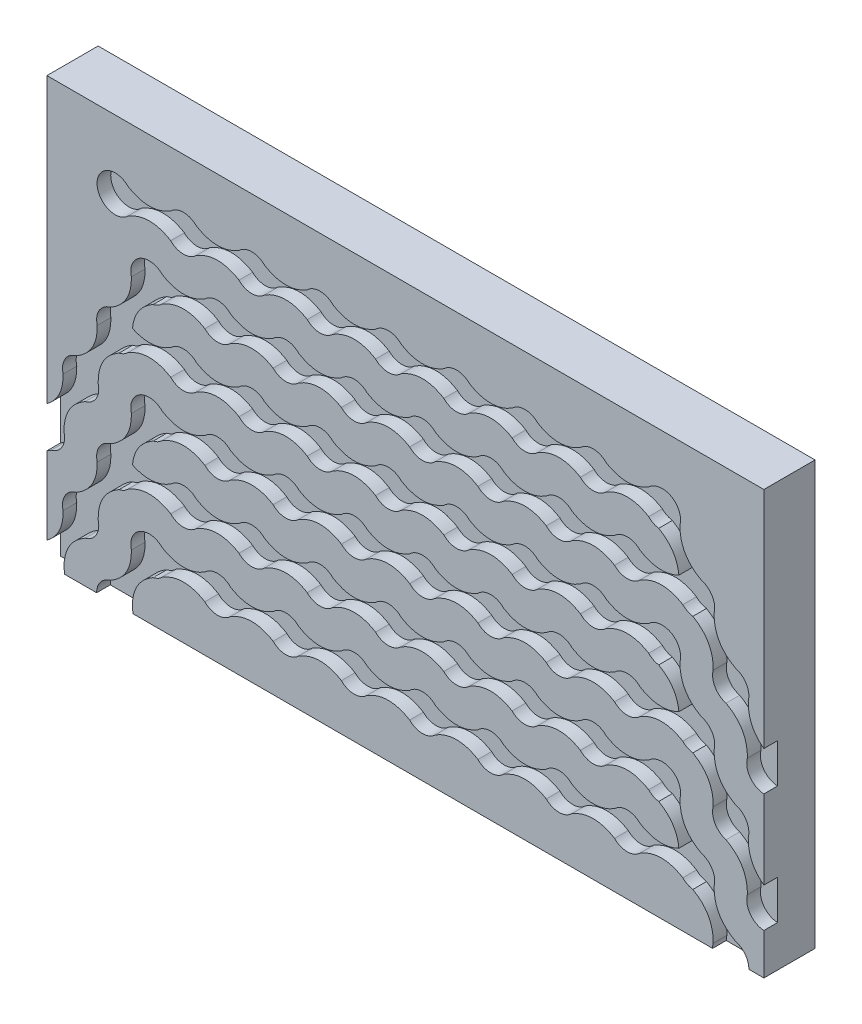
from build123d import *

# Parameters (mm, degrees)
SKETCH2_W               = 133.35
SKETCH2_H               = 78.691135768
BOSS_EXTRUDE1_DEPTH     = 9.525
CUT_EXTRUDE1_DEPTH      = 2.54
LPATTERN1_COUNT         = 8
LPATTERN1_PITCH         = 12.7
LPATTERN3_COPY_1_DEPTH  = 2.54
LPATTERN3_COPY_2_DEPTH  = 2.54
LPATTERN3_COPY_3_DEPTH  = 2.54
LPATTERN3_COPY_4_DEPTH  = 2.54
LPATTERN3_COPY_5_DEPTH  = 2.54
LPATTERN3_COPY_6_DEPTH  = 2.54
LPATTERN3_COPY_7_DEPTH  = 2.54
LPATTERN3_COPY_8_DEPTH  = 2.54
LPATTERN4_COUNT         = 3
LPATTERN4_PITCH         = 21.997045256
LPATTERN4_COPY_1_DEPTH  = 2.54
LPATTERN4_COPY_2_DEPTH  = 2.54
LPATTERN4_COPY_3_DEPTH  = 2.54
LPATTERN4_COPY_4_DEPTH  = 2.54
LPATTERN4_COPY_5_DEPTH  = 2.54
LPATTERN4_COPY_6_DEPTH  = 2.54
LPATTERN4_COPY_7_DEPTH  = 2.54
LPATTERN4_COPY_8_DEPTH  = 2.54
LPATTERN4_COPY_9_DEPTH  = 2.54
LPATTERN4_COPY_10_DEPTH = 2.54
LPATTERN4_COPY_11_DEPTH = 2.54
LPATTERN4_COPY_12_DEPTH = 2.54
LPATTERN4_COPY_13_DEPTH = 2.54
LPATTERN4_COPY_14_DEPTH = 2.54
LPATTERN4_COPY_15_DEPTH = 2.54
LPATTERN4_COPY_16_DEPTH = 2.54
LPATTERN4_COPY_17_DEPTH = 2.54
LPATTERN4_COPY_18_DEPTH = 2.54
LPATTERN4_COPY_19_DEPTH = 2.54
LPATTERN4_COPY_20_DEPTH = 2.54
LPATTERN4_COPY_21_DEPTH = 2.54
LPATTERN4_COPY_22_DEPTH = 2.54
LPATTERN4_COPY_23_DEPTH = 2.54
LPATTERN4_COPY_24_DEPTH = 2.54
LPATTERN4_COPY_25_DEPTH = 2.54
LPATTERN4_COPY_26_DEPTH = 2.54
LPATTERN4_COPY_27_DEPTH = 2.54
LPATTERN4_COPY_28_DEPTH = 2.54
LPATTERN4_COPY_29_DEPTH = 2.54
LPATTERN4_COPY_30_DEPTH = 2.54
CUT_EXTRUDE2_DEPTH      = 2.54
LPATTERN5_COUNT         = 3
LPATTERN5_PITCH         = 12.7
LPATTERN6_COPY_1_DEPTH  = 2.54
LPATTERN6_COPY_2_DEPTH  = 2.54
LPATTERN6_COPY_3_DEPTH  = 2.54
LPATTERN6_COPY_4_DEPTH  = 2.54
LPATTERN6_COPY_5_DEPTH  = 2.54
LPATTERN6_COPY_6_DEPTH  = 2.54
CUT_EXTRUDE3_DEPTH      = 2.54
LPATTERN7_COUNT         = 4
LPATTERN7_PITCH         = 12.7
LPATTERN8_COPY_1_DEPTH  = 2.54
LPATTERN8_COPY_2_DEPTH  = 2.54
LPATTERN8_COPY_3_DEPTH  = 2.54
LPATTERN8_COPY_4_DEPTH  = 2.54
LPATTERN8_COPY_5_DEPTH  = 2.54
LPATTERN8_COPY_6_DEPTH  = 2.54
LPATTERN8_COPY_7_DEPTH  = 2.54
LPATTERN8_COPY_8_DEPTH  = 2.54
SCALE1_SCALE            = 0.75


with BuildPart() as part:
    # Sketch2 → Boss-Extrude1 (new body)
    with BuildSketch(Plane.XY):
        with Locations((35.614124974, 7.974602086)):
            Rectangle(SKETCH2_W, SKETCH2_H)
    extrude(amount=BOSS_EXTRUDE1_DEPTH)

    # Sketch1 → Cut-Extrude1 (cut)
    with BuildSketch(Plane.XY.offset(9.525)):
        with BuildLine():
            ThreePointArc((-15.975494494, 37.005550502), (-21.734312526, 34.62016997), (-15.975494494, 32.234789438))
            add(Edge.make_bspline(
                [(-15.975494494, 32.234789438), (-12.010875026, 34.624300502), (-8.046255558, 32.234789438)],
                knots=[0, 0, 0, 1, 1, 1], degree=2))
            ThreePointArc((-8.046255558, 32.234789438), (-2.287437526, 34.62016997), (-8.046255558, 37.005550502))
            add(Edge.make_bspline(
                [(-15.975494494, 37.005550502), (-12.010875026, 34.616039438), (-8.046255558, 37.005550502)],
                knots=[0, 0, 0, 1, 1, 1], degree=2))
        make_face()
    cut_extrude1 = extrude(amount=-CUT_EXTRUDE1_DEPTH, mode=Mode.SUBTRACT)

    # LPattern1: Cut-Extrude1 ×8
    with Locations(*[(i * LPATTERN1_PITCH, 0, 0) for i in range(1, LPATTERN1_COUNT)]):
        add(cut_extrude1, mode=Mode.SUBTRACT)

    # LPattern3 copy 1 sketch → LPattern3 copy 1 (cut)
    with BuildSketch(Plane(origin=(19.05, -10.998522628, 9.525), x_dir=(1, 0, 0), z_dir=(0, 0, 1))):
        with BuildLine():
            ThreePointArc((-15.975494494, 37.005550502), (-21.734312526, 34.62016997), (-15.975494494, 32.234789438))
            add(Edge.make_bspline(
                [(-15.975494494, 32.234789438), (-12.010875026, 34.624300502), (-8.046255558, 32.234789438)],
                knots=[0, 0, 0, 1, 1, 1], degree=2))
            ThreePointArc((-8.046255558, 32.234789438), (-2.287437526, 34.62016997), (-8.046255558, 37.005550502))
            add(Edge.make_bspline(
                [(-15.975494494, 37.005550502), (-12.010875026, 34.616039438), (-8.046255558, 37.005550502)],
                knots=[0, 0, 0, 1, 1, 1], degree=2))
        make_face()
    extrude(amount=-LPATTERN3_COPY_1_DEPTH, mode=Mode.SUBTRACT)

    # LPattern3 copy 2 sketch → LPattern3 copy 2 (cut)
    with BuildSketch(Plane(origin=(31.75, -10.998522628, 9.525), x_dir=(1, 0, 0), z_dir=(0, 0, 1))):
        with BuildLine():
            ThreePointArc((-15.975494494, 37.005550502), (-21.734312526, 34.62016997), (-15.975494494, 32.234789438))
            add(Edge.make_bspline(
                [(-15.975494494, 32.234789438), (-12.010875026, 34.624300502), (-8.046255558, 32.234789438)],
                knots=[0, 0, 0, 1, 1, 1], degree=2))
            ThreePointArc((-8.046255558, 32.234789438), (-2.287437526, 34.62016997), (-8.046255558, 37.005550502))
            add(Edge.make_bspline(
                [(-15.975494494, 37.005550502), (-12.010875026, 34.616039438), (-8.046255558, 37.005550502)],
                knots=[0, 0, 0, 1, 1, 1], degree=2))
        make_face()
    extrude(amount=-LPATTERN3_COPY_2_DEPTH, mode=Mode.SUBTRACT)

    # LPattern3 copy 3 sketch → LPattern3 copy 3 (cut)
    with BuildSketch(Plane(origin=(44.45, -10.998522628, 9.525), x_dir=(1, 0, 0), z_dir=(0, 0, 1))):
        with BuildLine():
            ThreePointArc((-15.975494494, 37.005550502), (-21.734312526, 34.62016997), (-15.975494494, 32.234789438))
            add(Edge.make_bspline(
                [(-15.975494494, 32.234789438), (-12.010875026, 34.624300502), (-8.046255558, 32.234789438)],
                knots=[0, 0, 0, 1, 1, 1], degree=2))
            ThreePointArc((-8.046255558, 32.234789438), (-2.287437526, 34.62016997), (-8.046255558, 37.005550502))
            add(Edge.make_bspline(
                [(-15.975494494, 37.005550502), (-12.010875026, 34.616039438), (-8.046255558, 37.005550502)],
                knots=[0, 0, 0, 1, 1, 1], degree=2))
        make_face()
    extrude(amount=-LPATTERN3_COPY_3_DEPTH, mode=Mode.SUBTRACT)

    # LPattern3 copy 4 sketch → LPattern3 copy 4 (cut)
    with BuildSketch(Plane(origin=(57.15, -10.998522628, 9.525), x_dir=(1, 0, 0), z_dir=(0, 0, 1))):
        with BuildLine():
            ThreePointArc((-15.975494494, 37.005550502), (-21.734312526, 34.62016997), (-15.975494494, 32.234789438))
            add(Edge.make_bspline(
                [(-15.975494494, 32.234789438), (-12.010875026, 34.624300502), (-8.046255558, 32.234789438)],
                knots=[0, 0, 0, 1, 1, 1], degree=2))
            ThreePointArc((-8.046255558, 32.234789438), (-2.287437526, 34.62016997), (-8.046255558, 37.005550502))
            add(Edge.make_bspline(
                [(-15.975494494, 37.005550502), (-12.010875026, 34.616039438), (-8.046255558, 37.005550502)],
                knots=[0, 0, 0, 1, 1, 1], degree=2))
        make_face()
    extrude(amount=-LPATTERN3_COPY_4_DEPTH, mode=Mode.SUBTRACT)

    # LPattern3 copy 5 sketch → LPattern3 copy 5 (cut)
    with BuildSketch(Plane(origin=(69.85, -10.998522628, 9.525), x_dir=(1, 0, 0), z_dir=(0, 0, 1))):
        with BuildLine():
            ThreePointArc((-15.975494494, 37.005550502), (-21.734312526, 34.62016997), (-15.975494494, 32.234789438))
            add(Edge.make_bspline(
                [(-15.975494494, 32.234789438), (-12.010875026, 34.624300502), (-8.046255558, 32.234789438)],
                knots=[0, 0, 0, 1, 1, 1], degree=2))
            ThreePointArc((-8.046255558, 32.234789438), (-2.287437526, 34.62016997), (-8.046255558, 37.005550502))
            add(Edge.make_bspline(
                [(-15.975494494, 37.005550502), (-12.010875026, 34.616039438), (-8.046255558, 37.005550502)],
                knots=[0, 0, 0, 1, 1, 1], degree=2))
        make_face()
    extrude(amount=-LPATTERN3_COPY_5_DEPTH, mode=Mode.SUBTRACT)

    # LPattern3 copy 6 sketch → LPattern3 copy 6 (cut)
    with BuildSketch(Plane(origin=(82.55, -10.998522628, 9.525), x_dir=(1, 0, 0), z_dir=(0, 0, 1))):
        with BuildLine():
            ThreePointArc((-15.975494494, 37.005550502), (-21.734312526, 34.62016997), (-15.975494494, 32.234789438))
            add(Edge.make_bspline(
                [(-15.975494494, 32.234789438), (-12.010875026, 34.624300502), (-8.046255558, 32.234789438)],
                knots=[0, 0, 0, 1, 1, 1], degree=2))
            ThreePointArc((-8.046255558, 32.234789438), (-2.287437526, 34.62016997), (-8.046255558, 37.005550502))
            add(Edge.make_bspline(
                [(-15.975494494, 37.005550502), (-12.010875026, 34.616039438), (-8.046255558, 37.005550502)],
                knots=[0, 0, 0, 1, 1, 1], degree=2))
        make_face()
    extrude(amount=-LPATTERN3_COPY_6_DEPTH, mode=Mode.SUBTRACT)

    # LPattern3 copy 7 sketch → LPattern3 copy 7 (cut)
    with BuildSketch(Plane(origin=(95.25, -10.998522628, 9.525), x_dir=(1, 0, 0), z_dir=(0, 0, 1))):
        with BuildLine():
            ThreePointArc((-15.975494494, 37.005550502), (-21.734312526, 34.62016997), (-15.975494494, 32.234789438))
            add(Edge.make_bspline(
                [(-15.975494494, 32.234789438), (-12.010875026, 34.624300502), (-8.046255558, 32.234789438)],
                knots=[0, 0, 0, 1, 1, 1], degree=2))
            ThreePointArc((-8.046255558, 32.234789438), (-2.287437526, 34.62016997), (-8.046255558, 37.005550502))
            add(Edge.make_bspline(
                [(-15.975494494, 37.005550502), (-12.010875026, 34.616039438), (-8.046255558, 37.005550502)],
                knots=[0, 0, 0, 1, 1, 1], degree=2))
        make_face()
    extrude(amount=-LPATTERN3_COPY_7_DEPTH, mode=Mode.SUBTRACT)

    # LPattern3 copy 8 sketch → LPattern3 copy 8 (cut)
    with BuildSketch(Plane(origin=(6.35, -10.998522628, 9.525), x_dir=(1, 0, 0), z_dir=(0, 0, 1))):
        with BuildLine():
            ThreePointArc((-15.975494494, 37.005550502), (-21.734312526, 34.62016997), (-15.975494494, 32.234789438))
            add(Edge.make_bspline(
                [(-15.975494494, 32.234789438), (-12.010875026, 34.624300502), (-8.046255558, 32.234789438)],
                knots=[0, 0, 0, 1, 1, 1], degree=2))
            ThreePointArc((-8.046255558, 32.234789438), (-2.287437526, 34.62016997), (-8.046255558, 37.005550502))
            add(Edge.make_bspline(
                [(-15.975494494, 37.005550502), (-12.010875026, 34.616039438), (-8.046255558, 37.005550502)],
                knots=[0, 0, 0, 1, 1, 1], degree=2))
        make_face()
    extrude(amount=-LPATTERN3_COPY_8_DEPTH, mode=Mode.SUBTRACT)

    # LPattern4: Cut-Extrude1 ×3
    with Locations(*[(0, -i * LPATTERN4_PITCH, 0) for i in range(1, LPATTERN4_COUNT)]):
        add(cut_extrude1, mode=Mode.SUBTRACT)

    # LPattern4 copy 1 sketch → LPattern4 copy 1 (cut)
    with BuildSketch(Plane(origin=(12.7, -21.997045256, 9.525), x_dir=(1, 0, 0), z_dir=(0, 0, 1))):
        with BuildLine():
            ThreePointArc((-15.975494494, 37.005550502), (-21.734312526, 34.62016997), (-15.975494494, 32.234789438))
            add(Edge.make_bspline(
                [(-15.975494494, 32.234789438), (-12.010875026, 34.624300502), (-8.046255558, 32.234789438)],
                knots=[0, 0, 0, 1, 1, 1], degree=2))
            ThreePointArc((-8.046255558, 32.234789438), (-2.287437526, 34.62016997), (-8.046255558, 37.005550502))
            add(Edge.make_bspline(
                [(-15.975494494, 37.005550502), (-12.010875026, 34.616039438), (-8.046255558, 37.005550502)],
                knots=[0, 0, 0, 1, 1, 1], degree=2))
        make_face()
    extrude(amount=-LPATTERN4_COPY_1_DEPTH, mode=Mode.SUBTRACT)

    # LPattern4 copy 2 sketch → LPattern4 copy 2 (cut)
    with BuildSketch(Plane(origin=(12.7, -43.994090512, 9.525), x_dir=(1, 0, 0), z_dir=(0, 0, 1))):
        with BuildLine():
            ThreePointArc((-15.975494494, 37.005550502), (-21.734312526, 34.62016997), (-15.975494494, 32.234789438))
            add(Edge.make_bspline(
                [(-15.975494494, 32.234789438), (-12.010875026, 34.624300502), (-8.046255558, 32.234789438)],
                knots=[0, 0, 0, 1, 1, 1], degree=2))
            ThreePointArc((-8.046255558, 32.234789438), (-2.287437526, 34.62016997), (-8.046255558, 37.005550502))
            add(Edge.make_bspline(
                [(-15.975494494, 37.005550502), (-12.010875026, 34.616039438), (-8.046255558, 37.005550502)],
                knots=[0, 0, 0, 1, 1, 1], degree=2))
        make_face()
    extrude(amount=-LPATTERN4_COPY_2_DEPTH, mode=Mode.SUBTRACT)

    # LPattern4 copy 3 sketch → LPattern4 copy 3 (cut)
    with BuildSketch(Plane(origin=(25.4, -21.997045256, 9.525), x_dir=(1, 0, 0), z_dir=(0, 0, 1))):
        with BuildLine():
            ThreePointArc((-15.975494494, 37.005550502), (-21.734312526, 34.62016997), (-15.975494494, 32.234789438))
            add(Edge.make_bspline(
                [(-15.975494494, 32.234789438), (-12.010875026, 34.624300502), (-8.046255558, 32.234789438)],
                knots=[0, 0, 0, 1, 1, 1], degree=2))
            ThreePointArc((-8.046255558, 32.234789438), (-2.287437526, 34.62016997), (-8.046255558, 37.005550502))
            add(Edge.make_bspline(
                [(-15.975494494, 37.005550502), (-12.010875026, 34.616039438), (-8.046255558, 37.005550502)],
                knots=[0, 0, 0, 1, 1, 1], degree=2))
        make_face()
    extrude(amount=-LPATTERN4_COPY_3_DEPTH, mode=Mode.SUBTRACT)

    # LPattern4 copy 4 sketch → LPattern4 copy 4 (cut)
    with BuildSketch(Plane(origin=(25.4, -43.994090512, 9.525), x_dir=(1, 0, 0), z_dir=(0, 0, 1))):
        with BuildLine():
            ThreePointArc((-15.975494494, 37.005550502), (-21.734312526, 34.62016997), (-15.975494494, 32.234789438))
            add(Edge.make_bspline(
                [(-15.975494494, 32.234789438), (-12.010875026, 34.624300502), (-8.046255558, 32.234789438)],
                knots=[0, 0, 0, 1, 1, 1], degree=2))
            ThreePointArc((-8.046255558, 32.234789438), (-2.287437526, 34.62016997), (-8.046255558, 37.005550502))
            add(Edge.make_bspline(
                [(-15.975494494, 37.005550502), (-12.010875026, 34.616039438), (-8.046255558, 37.005550502)],
                knots=[0, 0, 0, 1, 1, 1], degree=2))
        make_face()
    extrude(amount=-LPATTERN4_COPY_4_DEPTH, mode=Mode.SUBTRACT)

    # LPattern4 copy 5 sketch → LPattern4 copy 5 (cut)
    with BuildSketch(Plane(origin=(38.1, -21.997045256, 9.525), x_dir=(1, 0, 0), z_dir=(0, 0, 1))):
        with BuildLine():
            ThreePointArc((-15.975494494, 37.005550502), (-21.734312526, 34.62016997), (-15.975494494, 32.234789438))
            add(Edge.make_bspline(
                [(-15.975494494, 32.234789438), (-12.010875026, 34.624300502), (-8.046255558, 32.234789438)],
                knots=[0, 0, 0, 1, 1, 1], degree=2))
            ThreePointArc((-8.046255558, 32.234789438), (-2.287437526, 34.62016997), (-8.046255558, 37.005550502))
            add(Edge.make_bspline(
                [(-15.975494494, 37.005550502), (-12.010875026, 34.616039438), (-8.046255558, 37.005550502)],
                knots=[0, 0, 0, 1, 1, 1], degree=2))
        make_face()
    extrude(amount=-LPATTERN4_COPY_5_DEPTH, mode=Mode.SUBTRACT)

    # LPattern4 copy 6 sketch → LPattern4 copy 6 (cut)
    with BuildSketch(Plane(origin=(38.1, -43.994090512, 9.525), x_dir=(1, 0, 0), z_dir=(0, 0, 1))):
        with BuildLine():
            ThreePointArc((-15.975494494, 37.005550502), (-21.734312526, 34.62016997), (-15.975494494, 32.234789438))
            add(Edge.make_bspline(
                [(-15.975494494, 32.234789438), (-12.010875026, 34.624300502), (-8.046255558, 32.234789438)],
                knots=[0, 0, 0, 1, 1, 1], degree=2))
            ThreePointArc((-8.046255558, 32.234789438), (-2.287437526, 34.62016997), (-8.046255558, 37.005550502))
            add(Edge.make_bspline(
                [(-15.975494494, 37.005550502), (-12.010875026, 34.616039438), (-8.046255558, 37.005550502)],
                knots=[0, 0, 0, 1, 1, 1], degree=2))
        make_face()
    extrude(amount=-LPATTERN4_COPY_6_DEPTH, mode=Mode.SUBTRACT)

    # LPattern4 copy 7 sketch → LPattern4 copy 7 (cut)
    with BuildSketch(Plane(origin=(50.8, -21.997045256, 9.525), x_dir=(1, 0, 0), z_dir=(0, 0, 1))):
        with BuildLine():
            ThreePointArc((-15.975494494, 37.005550502), (-21.734312526, 34.62016997), (-15.975494494, 32.234789438))
            add(Edge.make_bspline(
                [(-15.975494494, 32.234789438), (-12.010875026, 34.624300502), (-8.046255558, 32.234789438)],
                knots=[0, 0, 0, 1, 1, 1], degree=2))
            ThreePointArc((-8.046255558, 32.234789438), (-2.287437526, 34.62016997), (-8.046255558, 37.005550502))
            add(Edge.make_bspline(
                [(-15.975494494, 37.005550502), (-12.010875026, 34.616039438), (-8.046255558, 37.005550502)],
                knots=[0, 0, 0, 1, 1, 1], degree=2))
        make_face()
    extrude(amount=-LPATTERN4_COPY_7_DEPTH, mode=Mode.SUBTRACT)

    # LPattern4 copy 8 sketch → LPattern4 copy 8 (cut)
    with BuildSketch(Plane(origin=(50.8, -43.994090512, 9.525), x_dir=(1, 0, 0), z_dir=(0, 0, 1))):
        with BuildLine():
            ThreePointArc((-15.975494494, 37.005550502), (-21.734312526, 34.62016997), (-15.975494494, 32.234789438))
            add(Edge.make_bspline(
                [(-15.975494494, 32.234789438), (-12.010875026, 34.624300502), (-8.046255558, 32.234789438)],
                knots=[0, 0, 0, 1, 1, 1], degree=2))
            ThreePointArc((-8.046255558, 32.234789438), (-2.287437526, 34.62016997), (-8.046255558, 37.005550502))
            add(Edge.make_bspline(
                [(-15.975494494, 37.005550502), (-12.010875026, 34.616039438), (-8.046255558, 37.005550502)],
                knots=[0, 0, 0, 1, 1, 1], degree=2))
        make_face()
    extrude(amount=-LPATTERN4_COPY_8_DEPTH, mode=Mode.SUBTRACT)

    # LPattern4 copy 9 sketch → LPattern4 copy 9 (cut)
    with BuildSketch(Plane(origin=(63.5, -21.997045256, 9.525), x_dir=(1, 0, 0), z_dir=(0, 0, 1))):
        with BuildLine():
            ThreePointArc((-15.975494494, 37.005550502), (-21.734312526, 34.62016997), (-15.975494494, 32.234789438))
            add(Edge.make_bspline(
                [(-15.975494494, 32.234789438), (-12.010875026, 34.624300502), (-8.046255558, 32.234789438)],
                knots=[0, 0, 0, 1, 1, 1], degree=2))
            ThreePointArc((-8.046255558, 32.234789438), (-2.287437526, 34.62016997), (-8.046255558, 37.005550502))
            add(Edge.make_bspline(
                [(-15.975494494, 37.005550502), (-12.010875026, 34.616039438), (-8.046255558, 37.005550502)],
                knots=[0, 0, 0, 1, 1, 1], degree=2))
        make_face()
    extrude(amount=-LPATTERN4_COPY_9_DEPTH, mode=Mode.SUBTRACT)

    # LPattern4 copy 10 sketch → LPattern4 copy 10 (cut)
    with BuildSketch(Plane(origin=(63.5, -43.994090512, 9.525), x_dir=(1, 0, 0), z_dir=(0, 0, 1))):
        with BuildLine():
            ThreePointArc((-15.975494494, 37.005550502), (-21.734312526, 34.62016997), (-15.975494494, 32.234789438))
            add(Edge.make_bspline(
                [(-15.975494494, 32.234789438), (-12.010875026, 34.624300502), (-8.046255558, 32.234789438)],
                knots=[0, 0, 0, 1, 1, 1], degree=2))
            ThreePointArc((-8.046255558, 32.234789438), (-2.287437526, 34.62016997), (-8.046255558, 37.005550502))
            add(Edge.make_bspline(
                [(-15.975494494, 37.005550502), (-12.010875026, 34.616039438), (-8.046255558, 37.005550502)],
                knots=[0, 0, 0, 1, 1, 1], degree=2))
        make_face()
    extrude(amount=-LPATTERN4_COPY_10_DEPTH, mode=Mode.SUBTRACT)

    # LPattern4 copy 11 sketch → LPattern4 copy 11 (cut)
    with BuildSketch(Plane(origin=(76.2, -21.997045256, 9.525), x_dir=(1, 0, 0), z_dir=(0, 0, 1))):
        with BuildLine():
            ThreePointArc((-15.975494494, 37.005550502), (-21.734312526, 34.62016997), (-15.975494494, 32.234789438))
            add(Edge.make_bspline(
                [(-15.975494494, 32.234789438), (-12.010875026, 34.624300502), (-8.046255558, 32.234789438)],
                knots=[0, 0, 0, 1, 1, 1], degree=2))
            ThreePointArc((-8.046255558, 32.234789438), (-2.287437526, 34.62016997), (-8.046255558, 37.005550502))
            add(Edge.make_bspline(
                [(-15.975494494, 37.005550502), (-12.010875026, 34.616039438), (-8.046255558, 37.005550502)],
                knots=[0, 0, 0, 1, 1, 1], degree=2))
        make_face()
    extrude(amount=-LPATTERN4_COPY_11_DEPTH, mode=Mode.SUBTRACT)

    # LPattern4 copy 12 sketch → LPattern4 copy 12 (cut)
    with BuildSketch(Plane(origin=(76.2, -43.994090512, 9.525), x_dir=(1, 0, 0), z_dir=(0, 0, 1))):
        with BuildLine():
            ThreePointArc((-15.975494494, 37.005550502), (-21.734312526, 34.62016997), (-15.975494494, 32.234789438))
            add(Edge.make_bspline(
                [(-15.975494494, 32.234789438), (-12.010875026, 34.624300502), (-8.046255558, 32.234789438)],
                knots=[0, 0, 0, 1, 1, 1], degree=2))
            ThreePointArc((-8.046255558, 32.234789438), (-2.287437526, 34.62016997), (-8.046255558, 37.005550502))
            add(Edge.make_bspline(
                [(-15.975494494, 37.005550502), (-12.010875026, 34.616039438), (-8.046255558, 37.005550502)],
                knots=[0, 0, 0, 1, 1, 1], degree=2))
        make_face()
    extrude(amount=-LPATTERN4_COPY_12_DEPTH, mode=Mode.SUBTRACT)

    # LPattern4 copy 13 sketch → LPattern4 copy 13 (cut)
    with BuildSketch(Plane(origin=(88.9, -21.997045256, 9.525), x_dir=(1, 0, 0), z_dir=(0, 0, 1))):
        with BuildLine():
            ThreePointArc((-15.975494494, 37.005550502), (-21.734312526, 34.62016997), (-15.975494494, 32.234789438))
            add(Edge.make_bspline(
                [(-15.975494494, 32.234789438), (-12.010875026, 34.624300502), (-8.046255558, 32.234789438)],
                knots=[0, 0, 0, 1, 1, 1], degree=2))
            ThreePointArc((-8.046255558, 32.234789438), (-2.287437526, 34.62016997), (-8.046255558, 37.005550502))
            add(Edge.make_bspline(
                [(-15.975494494, 37.005550502), (-12.010875026, 34.616039438), (-8.046255558, 37.005550502)],
                knots=[0, 0, 0, 1, 1, 1], degree=2))
        make_face()
    extrude(amount=-LPATTERN4_COPY_13_DEPTH, mode=Mode.SUBTRACT)

    # LPattern4 copy 14 sketch → LPattern4 copy 14 (cut)
    with BuildSketch(Plane(origin=(88.9, -43.994090512, 9.525), x_dir=(1, 0, 0), z_dir=(0, 0, 1))):
        with BuildLine():
            ThreePointArc((-15.975494494, 37.005550502), (-21.734312526, 34.62016997), (-15.975494494, 32.234789438))
            add(Edge.make_bspline(
                [(-15.975494494, 32.234789438), (-12.010875026, 34.624300502), (-8.046255558, 32.234789438)],
                knots=[0, 0, 0, 1, 1, 1], degree=2))
            ThreePointArc((-8.046255558, 32.234789438), (-2.287437526, 34.62016997), (-8.046255558, 37.005550502))
            add(Edge.make_bspline(
                [(-15.975494494, 37.005550502), (-12.010875026, 34.616039438), (-8.046255558, 37.005550502)],
                knots=[0, 0, 0, 1, 1, 1], degree=2))
        make_face()
    extrude(amount=-LPATTERN4_COPY_14_DEPTH, mode=Mode.SUBTRACT)

    # LPattern4 copy 15 sketch → LPattern4 copy 15 (cut)
    with BuildSketch(Plane(origin=(19.05, -32.995567884, 9.525), x_dir=(1, 0, 0), z_dir=(0, 0, 1))):
        with BuildLine():
            ThreePointArc((-15.975494494, 37.005550502), (-21.734312526, 34.62016997), (-15.975494494, 32.234789438))
            add(Edge.make_bspline(
                [(-15.975494494, 32.234789438), (-12.010875026, 34.624300502), (-8.046255558, 32.234789438)],
                knots=[0, 0, 0, 1, 1, 1], degree=2))
            ThreePointArc((-8.046255558, 32.234789438), (-2.287437526, 34.62016997), (-8.046255558, 37.005550502))
            add(Edge.make_bspline(
                [(-15.975494494, 37.005550502), (-12.010875026, 34.616039438), (-8.046255558, 37.005550502)],
                knots=[0, 0, 0, 1, 1, 1], degree=2))
        make_face()
    extrude(amount=-LPATTERN4_COPY_15_DEPTH, mode=Mode.SUBTRACT)

    # LPattern4 copy 16 sketch → LPattern4 copy 16 (cut)
    with BuildSketch(Plane(origin=(19.05, -54.99261314, 9.525), x_dir=(1, 0, 0), z_dir=(0, 0, 1))):
        with BuildLine():
            ThreePointArc((-15.975494494, 37.005550502), (-21.734312526, 34.62016997), (-15.975494494, 32.234789438))
            add(Edge.make_bspline(
                [(-15.975494494, 32.234789438), (-12.010875026, 34.624300502), (-8.046255558, 32.234789438)],
                knots=[0, 0, 0, 1, 1, 1], degree=2))
            ThreePointArc((-8.046255558, 32.234789438), (-2.287437526, 34.62016997), (-8.046255558, 37.005550502))
            add(Edge.make_bspline(
                [(-15.975494494, 37.005550502), (-12.010875026, 34.616039438), (-8.046255558, 37.005550502)],
                knots=[0, 0, 0, 1, 1, 1], degree=2))
        make_face()
    extrude(amount=-LPATTERN4_COPY_16_DEPTH, mode=Mode.SUBTRACT)

    # LPattern4 copy 17 sketch → LPattern4 copy 17 (cut)
    with BuildSketch(Plane(origin=(31.75, -32.995567884, 9.525), x_dir=(1, 0, 0), z_dir=(0, 0, 1))):
        with BuildLine():
            ThreePointArc((-15.975494494, 37.005550502), (-21.734312526, 34.62016997), (-15.975494494, 32.234789438))
            add(Edge.make_bspline(
                [(-15.975494494, 32.234789438), (-12.010875026, 34.624300502), (-8.046255558, 32.234789438)],
                knots=[0, 0, 0, 1, 1, 1], degree=2))
            ThreePointArc((-8.046255558, 32.234789438), (-2.287437526, 34.62016997), (-8.046255558, 37.005550502))
            add(Edge.make_bspline(
                [(-15.975494494, 37.005550502), (-12.010875026, 34.616039438), (-8.046255558, 37.005550502)],
                knots=[0, 0, 0, 1, 1, 1], degree=2))
        make_face()
    extrude(amount=-LPATTERN4_COPY_17_DEPTH, mode=Mode.SUBTRACT)

    # LPattern4 copy 18 sketch → LPattern4 copy 18 (cut)
    with BuildSketch(Plane(origin=(31.75, -54.99261314, 9.525), x_dir=(1, 0, 0), z_dir=(0, 0, 1))):
        with BuildLine():
            ThreePointArc((-15.975494494, 37.005550502), (-21.734312526, 34.62016997), (-15.975494494, 32.234789438))
            add(Edge.make_bspline(
                [(-15.975494494, 32.234789438), (-12.010875026, 34.624300502), (-8.046255558, 32.234789438)],
                knots=[0, 0, 0, 1, 1, 1], degree=2))
            ThreePointArc((-8.046255558, 32.234789438), (-2.287437526, 34.62016997), (-8.046255558, 37.005550502))
            add(Edge.make_bspline(
                [(-15.975494494, 37.005550502), (-12.010875026, 34.616039438), (-8.046255558, 37.005550502)],
                knots=[0, 0, 0, 1, 1, 1], degree=2))
        make_face()
    extrude(amount=-LPATTERN4_COPY_18_DEPTH, mode=Mode.SUBTRACT)

    # LPattern4 copy 19 sketch → LPattern4 copy 19 (cut)
    with BuildSketch(Plane(origin=(44.45, -32.995567884, 9.525), x_dir=(1, 0, 0), z_dir=(0, 0, 1))):
        with BuildLine():
            ThreePointArc((-15.975494494, 37.005550502), (-21.734312526, 34.62016997), (-15.975494494, 32.234789438))
            add(Edge.make_bspline(
                [(-15.975494494, 32.234789438), (-12.010875026, 34.624300502), (-8.046255558, 32.234789438)],
                knots=[0, 0, 0, 1, 1, 1], degree=2))
            ThreePointArc((-8.046255558, 32.234789438), (-2.287437526, 34.62016997), (-8.046255558, 37.005550502))
            add(Edge.make_bspline(
                [(-15.975494494, 37.005550502), (-12.010875026, 34.616039438), (-8.046255558, 37.005550502)],
                knots=[0, 0, 0, 1, 1, 1], degree=2))
        make_face()
    extrude(amount=-LPATTERN4_COPY_19_DEPTH, mode=Mode.SUBTRACT)

    # LPattern4 copy 20 sketch → LPattern4 copy 20 (cut)
    with BuildSketch(Plane(origin=(44.45, -54.99261314, 9.525), x_dir=(1, 0, 0), z_dir=(0, 0, 1))):
        with BuildLine():
            ThreePointArc((-15.975494494, 37.005550502), (-21.734312526, 34.62016997), (-15.975494494, 32.234789438))
            add(Edge.make_bspline(
                [(-15.975494494, 32.234789438), (-12.010875026, 34.624300502), (-8.046255558, 32.234789438)],
                knots=[0, 0, 0, 1, 1, 1], degree=2))
            ThreePointArc((-8.046255558, 32.234789438), (-2.287437526, 34.62016997), (-8.046255558, 37.005550502))
            add(Edge.make_bspline(
                [(-15.975494494, 37.005550502), (-12.010875026, 34.616039438), (-8.046255558, 37.005550502)],
                knots=[0, 0, 0, 1, 1, 1], degree=2))
        make_face()
    extrude(amount=-LPATTERN4_COPY_20_DEPTH, mode=Mode.SUBTRACT)

    # LPattern4 copy 21 sketch → LPattern4 copy 21 (cut)
    with BuildSketch(Plane(origin=(57.15, -32.995567884, 9.525), x_dir=(1, 0, 0), z_dir=(0, 0, 1))):
        with BuildLine():
            ThreePointArc((-15.975494494, 37.005550502), (-21.734312526, 34.62016997), (-15.975494494, 32.234789438))
            add(Edge.make_bspline(
                [(-15.975494494, 32.234789438), (-12.010875026, 34.624300502), (-8.046255558, 32.234789438)],
                knots=[0, 0, 0, 1, 1, 1], degree=2))
            ThreePointArc((-8.046255558, 32.234789438), (-2.287437526, 34.62016997), (-8.046255558, 37.005550502))
            add(Edge.make_bspline(
                [(-15.975494494, 37.005550502), (-12.010875026, 34.616039438), (-8.046255558, 37.005550502)],
                knots=[0, 0, 0, 1, 1, 1], degree=2))
        make_face()
    extrude(amount=-LPATTERN4_COPY_21_DEPTH, mode=Mode.SUBTRACT)

    # LPattern4 copy 22 sketch → LPattern4 copy 22 (cut)
    with BuildSketch(Plane(origin=(57.15, -54.99261314, 9.525), x_dir=(1, 0, 0), z_dir=(0, 0, 1))):
        with BuildLine():
            ThreePointArc((-15.975494494, 37.005550502), (-21.734312526, 34.62016997), (-15.975494494, 32.234789438))
            add(Edge.make_bspline(
                [(-15.975494494, 32.234789438), (-12.010875026, 34.624300502), (-8.046255558, 32.234789438)],
                knots=[0, 0, 0, 1, 1, 1], degree=2))
            ThreePointArc((-8.046255558, 32.234789438), (-2.287437526, 34.62016997), (-8.046255558, 37.005550502))
            add(Edge.make_bspline(
                [(-15.975494494, 37.005550502), (-12.010875026, 34.616039438), (-8.046255558, 37.005550502)],
                knots=[0, 0, 0, 1, 1, 1], degree=2))
        make_face()
    extrude(amount=-LPATTERN4_COPY_22_DEPTH, mode=Mode.SUBTRACT)

    # LPattern4 copy 23 sketch → LPattern4 copy 23 (cut)
    with BuildSketch(Plane(origin=(69.85, -32.995567884, 9.525), x_dir=(1, 0, 0), z_dir=(0, 0, 1))):
        with BuildLine():
            ThreePointArc((-15.975494494, 37.005550502), (-21.734312526, 34.62016997), (-15.975494494, 32.234789438))
            add(Edge.make_bspline(
                [(-15.975494494, 32.234789438), (-12.010875026, 34.624300502), (-8.046255558, 32.234789438)],
                knots=[0, 0, 0, 1, 1, 1], degree=2))
            ThreePointArc((-8.046255558, 32.234789438), (-2.287437526, 34.62016997), (-8.046255558, 37.005550502))
            add(Edge.make_bspline(
                [(-15.975494494, 37.005550502), (-12.010875026, 34.616039438), (-8.046255558, 37.005550502)],
                knots=[0, 0, 0, 1, 1, 1], degree=2))
        make_face()
    extrude(amount=-LPATTERN4_COPY_23_DEPTH, mode=Mode.SUBTRACT)

    # LPattern4 copy 24 sketch → LPattern4 copy 24 (cut)
    with BuildSketch(Plane(origin=(69.85, -54.99261314, 9.525), x_dir=(1, 0, 0), z_dir=(0, 0, 1))):
        with BuildLine():
            ThreePointArc((-15.975494494, 37.005550502), (-21.734312526, 34.62016997), (-15.975494494, 32.234789438))
            add(Edge.make_bspline(
                [(-15.975494494, 32.234789438), (-12.010875026, 34.624300502), (-8.046255558, 32.234789438)],
                knots=[0, 0, 0, 1, 1, 1], degree=2))
            ThreePointArc((-8.046255558, 32.234789438), (-2.287437526, 34.62016997), (-8.046255558, 37.005550502))
            add(Edge.make_bspline(
                [(-15.975494494, 37.005550502), (-12.010875026, 34.616039438), (-8.046255558, 37.005550502)],
                knots=[0, 0, 0, 1, 1, 1], degree=2))
        make_face()
    extrude(amount=-LPATTERN4_COPY_24_DEPTH, mode=Mode.SUBTRACT)

    # LPattern4 copy 25 sketch → LPattern4 copy 25 (cut)
    with BuildSketch(Plane(origin=(82.55, -32.995567884, 9.525), x_dir=(1, 0, 0), z_dir=(0, 0, 1))):
        with BuildLine():
            ThreePointArc((-15.975494494, 37.005550502), (-21.734312526, 34.62016997), (-15.975494494, 32.234789438))
            add(Edge.make_bspline(
                [(-15.975494494, 32.234789438), (-12.010875026, 34.624300502), (-8.046255558, 32.234789438)],
                knots=[0, 0, 0, 1, 1, 1], degree=2))
            ThreePointArc((-8.046255558, 32.234789438), (-2.287437526, 34.62016997), (-8.046255558, 37.005550502))
            add(Edge.make_bspline(
                [(-15.975494494, 37.005550502), (-12.010875026, 34.616039438), (-8.046255558, 37.005550502)],
                knots=[0, 0, 0, 1, 1, 1], degree=2))
        make_face()
    extrude(amount=-LPATTERN4_COPY_25_DEPTH, mode=Mode.SUBTRACT)

    # LPattern4 copy 26 sketch → LPattern4 copy 26 (cut)
    with BuildSketch(Plane(origin=(82.55, -54.99261314, 9.525), x_dir=(1, 0, 0), z_dir=(0, 0, 1))):
        with BuildLine():
            ThreePointArc((-15.975494494, 37.005550502), (-21.734312526, 34.62016997), (-15.975494494, 32.234789438))
            add(Edge.make_bspline(
                [(-15.975494494, 32.234789438), (-12.010875026, 34.624300502), (-8.046255558, 32.234789438)],
                knots=[0, 0, 0, 1, 1, 1], degree=2))
            ThreePointArc((-8.046255558, 32.234789438), (-2.287437526, 34.62016997), (-8.046255558, 37.005550502))
            add(Edge.make_bspline(
                [(-15.975494494, 37.005550502), (-12.010875026, 34.616039438), (-8.046255558, 37.005550502)],
                knots=[0, 0, 0, 1, 1, 1], degree=2))
        make_face()
    extrude(amount=-LPATTERN4_COPY_26_DEPTH, mode=Mode.SUBTRACT)

    # LPattern4 copy 27 sketch → LPattern4 copy 27 (cut)
    with BuildSketch(Plane(origin=(95.25, -32.995567884, 9.525), x_dir=(1, 0, 0), z_dir=(0, 0, 1))):
        with BuildLine():
            ThreePointArc((-15.975494494, 37.005550502), (-21.734312526, 34.62016997), (-15.975494494, 32.234789438))
            add(Edge.make_bspline(
                [(-15.975494494, 32.234789438), (-12.010875026, 34.624300502), (-8.046255558, 32.234789438)],
                knots=[0, 0, 0, 1, 1, 1], degree=2))
            ThreePointArc((-8.046255558, 32.234789438), (-2.287437526, 34.62016997), (-8.046255558, 37.005550502))
            add(Edge.make_bspline(
                [(-15.975494494, 37.005550502), (-12.010875026, 34.616039438), (-8.046255558, 37.005550502)],
                knots=[0, 0, 0, 1, 1, 1], degree=2))
        make_face()
    extrude(amount=-LPATTERN4_COPY_27_DEPTH, mode=Mode.SUBTRACT)

    # LPattern4 copy 28 sketch → LPattern4 copy 28 (cut)
    with BuildSketch(Plane(origin=(95.25, -54.99261314, 9.525), x_dir=(1, 0, 0), z_dir=(0, 0, 1))):
        with BuildLine():
            ThreePointArc((-15.975494494, 37.005550502), (-21.734312526, 34.62016997), (-15.975494494, 32.234789438))
            add(Edge.make_bspline(
                [(-15.975494494, 32.234789438), (-12.010875026, 34.624300502), (-8.046255558, 32.234789438)],
                knots=[0, 0, 0, 1, 1, 1], degree=2))
            ThreePointArc((-8.046255558, 32.234789438), (-2.287437526, 34.62016997), (-8.046255558, 37.005550502))
            add(Edge.make_bspline(
                [(-15.975494494, 37.005550502), (-12.010875026, 34.616039438), (-8.046255558, 37.005550502)],
                knots=[0, 0, 0, 1, 1, 1], degree=2))
        make_face()
    extrude(amount=-LPATTERN4_COPY_28_DEPTH, mode=Mode.SUBTRACT)

    # LPattern4 copy 29 sketch → LPattern4 copy 29 (cut)
    with BuildSketch(Plane(origin=(6.35, -32.995567884, 9.525), x_dir=(1, 0, 0), z_dir=(0, 0, 1))):
        with BuildLine():
            ThreePointArc((-15.975494494, 37.005550502), (-21.734312526, 34.62016997), (-15.975494494, 32.234789438))
            add(Edge.make_bspline(
                [(-15.975494494, 32.234789438), (-12.010875026, 34.624300502), (-8.046255558, 32.234789438)],
                knots=[0, 0, 0, 1, 1, 1], degree=2))
            ThreePointArc((-8.046255558, 32.234789438), (-2.287437526, 34.62016997), (-8.046255558, 37.005550502))
            add(Edge.make_bspline(
                [(-15.975494494, 37.005550502), (-12.010875026, 34.616039438), (-8.046255558, 37.005550502)],
                knots=[0, 0, 0, 1, 1, 1], degree=2))
        make_face()
    extrude(amount=-LPATTERN4_COPY_29_DEPTH, mode=Mode.SUBTRACT)

    # LPattern4 copy 30 sketch → LPattern4 copy 30 (cut)
    with BuildSketch(Plane(origin=(6.35, -54.99261314, 9.525), x_dir=(1, 0, 0), z_dir=(0, 0, 1))):
        with BuildLine():
            ThreePointArc((-15.975494494, 37.005550502), (-21.734312526, 34.62016997), (-15.975494494, 32.234789438))
            add(Edge.make_bspline(
                [(-15.975494494, 32.234789438), (-12.010875026, 34.624300502), (-8.046255558, 32.234789438)],
                knots=[0, 0, 0, 1, 1, 1], degree=2))
            ThreePointArc((-8.046255558, 32.234789438), (-2.287437526, 34.62016997), (-8.046255558, 37.005550502))
            add(Edge.make_bspline(
                [(-15.975494494, 37.005550502), (-12.010875026, 34.616039438), (-8.046255558, 37.005550502)],
                knots=[0, 0, 0, 1, 1, 1], degree=2))
        make_face()
    extrude(amount=-LPATTERN4_COPY_30_DEPTH, mode=Mode.SUBTRACT)

    # Sketch6 → Cut-Extrude2 (cut)
    with BuildSketch(Plane.XY.offset(9.525)):
        with BuildLine():
            ThreePointArc((86.685122786, 33.771334445), (81.739913631, 37.565926891), (82.553522509, 31.385953913))
            add(Edge.make_bspline(
                [(82.553522509, 31.385953913), (86.605209527, 29.147248269), (86.518141977, 24.519031562)],
                knots=[0, 0, 0, 1, 1, 1], degree=2))
            ThreePointArc((86.518141977, 24.519031562), (91.463351131, 20.724439116), (90.649742254, 26.904412094))
            add(Edge.make_bspline(
                [(86.685122786, 33.771334445), (86.598055236, 29.143117737), (90.649742254, 26.904412094)],
                knots=[0, 0, 0, 1, 1, 1], degree=2))
        make_face()
    cut_extrude2 = extrude(amount=-CUT_EXTRUDE2_DEPTH, mode=Mode.SUBTRACT)

    # LPattern5: Cut-Extrude2 ×3
    with Locations(*[Vector(0.4999999999999982, -0.8660254037844397, 0) * (i * LPATTERN5_PITCH) for i in range(1, LPATTERN5_COUNT)]):
        add(cut_extrude2, mode=Mode.SUBTRACT)

    # LPattern6 copy 1 sketch → LPattern6 copy 1 (cut)
    with BuildSketch(Plane(origin=(6.35, -32.995567884, 9.525), x_dir=(1, 0, 0), z_dir=(0, 0, 1))):
        with BuildLine():
            ThreePointArc((86.685122786, 33.771334445), (81.739913631, 37.565926891), (82.553522509, 31.385953913))
            add(Edge.make_bspline(
                [(82.553522509, 31.385953913), (86.605209527, 29.147248269), (86.518141977, 24.519031562)],
                knots=[0, 0, 0, 1, 1, 1], degree=2))
            ThreePointArc((86.518141977, 24.519031562), (91.463351131, 20.724439116), (90.649742254, 26.904412094))
            add(Edge.make_bspline(
                [(86.685122786, 33.771334445), (86.598055236, 29.143117737), (90.649742254, 26.904412094)],
                knots=[0, 0, 0, 1, 1, 1], degree=2))
        make_face()
    extrude(amount=-LPATTERN6_COPY_1_DEPTH, mode=Mode.SUBTRACT)

    # LPattern6 copy 2 sketch → LPattern6 copy 2 (cut)
    with BuildSketch(Plane(origin=(6.35, -54.99261314, 9.525), x_dir=(1, 0, 0), z_dir=(0, 0, 1))):
        with BuildLine():
            ThreePointArc((86.685122786, 33.771334445), (81.739913631, 37.565926891), (82.553522509, 31.385953913))
            add(Edge.make_bspline(
                [(82.553522509, 31.385953913), (86.605209527, 29.147248269), (86.518141977, 24.519031562)],
                knots=[0, 0, 0, 1, 1, 1], degree=2))
            ThreePointArc((86.518141977, 24.519031562), (91.463351131, 20.724439116), (90.649742254, 26.904412094))
            add(Edge.make_bspline(
                [(86.685122786, 33.771334445), (86.598055236, 29.143117737), (90.649742254, 26.904412094)],
                knots=[0, 0, 0, 1, 1, 1], degree=2))
        make_face()
    extrude(amount=-LPATTERN6_COPY_2_DEPTH, mode=Mode.SUBTRACT)

    # LPattern6 copy 3 sketch → LPattern6 copy 3 (cut)
    with BuildSketch(Plane(origin=(12.7, -43.994090512, 9.525), x_dir=(1, 0, 0), z_dir=(0, 0, 1))):
        with BuildLine():
            ThreePointArc((86.685122786, 33.771334445), (81.739913631, 37.565926891), (82.553522509, 31.385953913))
            add(Edge.make_bspline(
                [(82.553522509, 31.385953913), (86.605209527, 29.147248269), (86.518141977, 24.519031562)],
                knots=[0, 0, 0, 1, 1, 1], degree=2))
            ThreePointArc((86.518141977, 24.519031562), (91.463351131, 20.724439116), (90.649742254, 26.904412094))
            add(Edge.make_bspline(
                [(86.685122786, 33.771334445), (86.598055236, 29.143117737), (90.649742254, 26.904412094)],
                knots=[0, 0, 0, 1, 1, 1], degree=2))
        make_face()
    extrude(amount=-LPATTERN6_COPY_3_DEPTH, mode=Mode.SUBTRACT)

    # LPattern6 copy 4 sketch → LPattern6 copy 4 (cut)
    with BuildSketch(Plane(origin=(12.7, -65.991135768, 9.525), x_dir=(1, 0, 0), z_dir=(0, 0, 1))):
        with BuildLine():
            ThreePointArc((86.685122786, 33.771334445), (81.739913631, 37.565926891), (82.553522509, 31.385953913))
            add(Edge.make_bspline(
                [(82.553522509, 31.385953913), (86.605209527, 29.147248269), (86.518141977, 24.519031562)],
                knots=[0, 0, 0, 1, 1, 1], degree=2))
            ThreePointArc((86.518141977, 24.519031562), (91.463351131, 20.724439116), (90.649742254, 26.904412094))
            add(Edge.make_bspline(
                [(86.685122786, 33.771334445), (86.598055236, 29.143117737), (90.649742254, 26.904412094)],
                knots=[0, 0, 0, 1, 1, 1], degree=2))
        make_face()
    extrude(amount=-LPATTERN6_COPY_4_DEPTH, mode=Mode.SUBTRACT)

    # LPattern6 copy 5 sketch → LPattern6 copy 5 (cut)
    with BuildSketch(Plane(origin=(0, -21.997045256, 9.525), x_dir=(1, 0, 0), z_dir=(0, 0, 1))):
        with BuildLine():
            ThreePointArc((86.685122786, 33.771334445), (81.739913631, 37.565926891), (82.553522509, 31.385953913))
            add(Edge.make_bspline(
                [(82.553522509, 31.385953913), (86.605209527, 29.147248269), (86.518141977, 24.519031562)],
                knots=[0, 0, 0, 1, 1, 1], degree=2))
            ThreePointArc((86.518141977, 24.519031562), (91.463351131, 20.724439116), (90.649742254, 26.904412094))
            add(Edge.make_bspline(
                [(86.685122786, 33.771334445), (86.598055236, 29.143117737), (90.649742254, 26.904412094)],
                knots=[0, 0, 0, 1, 1, 1], degree=2))
        make_face()
    extrude(amount=-LPATTERN6_COPY_5_DEPTH, mode=Mode.SUBTRACT)

    # LPattern6 copy 6 sketch → LPattern6 copy 6 (cut)
    with BuildSketch(Plane(origin=(0, -43.994090512, 9.525), x_dir=(1, 0, 0), z_dir=(0, 0, 1))):
        with BuildLine():
            ThreePointArc((86.685122786, 33.771334445), (81.739913631, 37.565926891), (82.553522509, 31.385953913))
            add(Edge.make_bspline(
                [(82.553522509, 31.385953913), (86.605209527, 29.147248269), (86.518141977, 24.519031562)],
                knots=[0, 0, 0, 1, 1, 1], degree=2))
            ThreePointArc((86.518141977, 24.519031562), (91.463351131, 20.724439116), (90.649742254, 26.904412094))
            add(Edge.make_bspline(
                [(86.685122786, 33.771334445), (86.598055236, 29.143117737), (90.649742254, 26.904412094)],
                knots=[0, 0, 0, 1, 1, 1], degree=2))
        make_face()
    extrude(amount=-LPATTERN6_COPY_6_DEPTH, mode=Mode.SUBTRACT)

    # Sketch7 → Cut-Extrude3 (cut)
    with BuildSketch(Plane.XY.offset(9.525)):
        with BuildLine():
            ThreePointArc((-19.315383726, 15.883666444), (-20.128992603, 9.703693467), (-15.183783449, 13.498285912))
            add(Edge.make_bspline(
                [(-15.183783449, 13.498285912), (-15.270850999, 18.12650262), (-11.219163981, 20.365208263)],
                knots=[0, 0, 0, 1, 1, 1], degree=2))
            ThreePointArc((-11.219163981, 20.365208263), (-10.405555103, 26.545181241), (-15.350764258, 22.750588795))
            add(Edge.make_bspline(
                [(-19.315383726, 15.883666444), (-15.263696708, 18.122372088), (-15.350764258, 22.750588795)],
                knots=[0, 0, 0, 1, 1, 1], degree=2))
        make_face()
    cut_extrude3 = extrude(amount=-CUT_EXTRUDE3_DEPTH, mode=Mode.SUBTRACT)

    # LPattern7: Cut-Extrude3 ×4
    with Locations(*[Vector(-0.5, -0.8660254037844387, 0) * (i * LPATTERN7_PITCH) for i in range(1, LPATTERN7_COUNT)]):
        add(cut_extrude3, mode=Mode.SUBTRACT)

    # LPattern8 copy 1 sketch → LPattern8 copy 1 (cut)
    with BuildSketch(Plane(origin=(-6.35, -32.995567884, 9.525), x_dir=(1, 0, 0), z_dir=(0, 0, 1))):
        with BuildLine():
            ThreePointArc((-19.315383726, 15.883666444), (-20.128992603, 9.703693467), (-15.183783449, 13.498285912))
            add(Edge.make_bspline(
                [(-15.183783449, 13.498285912), (-15.270850999, 18.12650262), (-11.219163981, 20.365208263)],
                knots=[0, 0, 0, 1, 1, 1], degree=2))
            ThreePointArc((-11.219163981, 20.365208263), (-10.405555103, 26.545181241), (-15.350764258, 22.750588795))
            add(Edge.make_bspline(
                [(-19.315383726, 15.883666444), (-15.263696708, 18.122372088), (-15.350764258, 22.750588795)],
                knots=[0, 0, 0, 1, 1, 1], degree=2))
        make_face()
    extrude(amount=-LPATTERN8_COPY_1_DEPTH, mode=Mode.SUBTRACT)

    # LPattern8 copy 2 sketch → LPattern8 copy 2 (cut)
    with BuildSketch(Plane(origin=(-6.35, -54.99261314, 9.525), x_dir=(1, 0, 0), z_dir=(0, 0, 1))):
        with BuildLine():
            ThreePointArc((-19.315383726, 15.883666444), (-20.128992603, 9.703693467), (-15.183783449, 13.498285912))
            add(Edge.make_bspline(
                [(-15.183783449, 13.498285912), (-15.270850999, 18.12650262), (-11.219163981, 20.365208263)],
                knots=[0, 0, 0, 1, 1, 1], degree=2))
            ThreePointArc((-11.219163981, 20.365208263), (-10.405555103, 26.545181241), (-15.350764258, 22.750588795))
            add(Edge.make_bspline(
                [(-19.315383726, 15.883666444), (-15.263696708, 18.122372088), (-15.350764258, 22.750588795)],
                knots=[0, 0, 0, 1, 1, 1], degree=2))
        make_face()
    extrude(amount=-LPATTERN8_COPY_2_DEPTH, mode=Mode.SUBTRACT)

    # LPattern8 copy 3 sketch → LPattern8 copy 3 (cut)
    with BuildSketch(Plane(origin=(-12.7, -43.994090512, 9.525), x_dir=(1, 0, 0), z_dir=(0, 0, 1))):
        with BuildLine():
            ThreePointArc((-19.315383726, 15.883666444), (-20.128992603, 9.703693467), (-15.183783449, 13.498285912))
            add(Edge.make_bspline(
                [(-15.183783449, 13.498285912), (-15.270850999, 18.12650262), (-11.219163981, 20.365208263)],
                knots=[0, 0, 0, 1, 1, 1], degree=2))
            ThreePointArc((-11.219163981, 20.365208263), (-10.405555103, 26.545181241), (-15.350764258, 22.750588795))
            add(Edge.make_bspline(
                [(-19.315383726, 15.883666444), (-15.263696708, 18.122372088), (-15.350764258, 22.750588795)],
                knots=[0, 0, 0, 1, 1, 1], degree=2))
        make_face()
    extrude(amount=-LPATTERN8_COPY_3_DEPTH, mode=Mode.SUBTRACT)

    # LPattern8 copy 4 sketch → LPattern8 copy 4 (cut)
    with BuildSketch(Plane(origin=(-12.7, -65.991135768, 9.525), x_dir=(1, 0, 0), z_dir=(0, 0, 1))):
        with BuildLine():
            ThreePointArc((-19.315383726, 15.883666444), (-20.128992603, 9.703693467), (-15.183783449, 13.498285912))
            add(Edge.make_bspline(
                [(-15.183783449, 13.498285912), (-15.270850999, 18.12650262), (-11.219163981, 20.365208263)],
                knots=[0, 0, 0, 1, 1, 1], degree=2))
            ThreePointArc((-11.219163981, 20.365208263), (-10.405555103, 26.545181241), (-15.350764258, 22.750588795))
            add(Edge.make_bspline(
                [(-19.315383726, 15.883666444), (-15.263696708, 18.122372088), (-15.350764258, 22.750588795)],
                knots=[0, 0, 0, 1, 1, 1], degree=2))
        make_face()
    extrude(amount=-LPATTERN8_COPY_4_DEPTH, mode=Mode.SUBTRACT)

    # LPattern8 copy 5 sketch → LPattern8 copy 5 (cut)
    with BuildSketch(Plane(origin=(-19.05, -54.99261314, 9.525), x_dir=(1, 0, 0), z_dir=(0, 0, 1))):
        with BuildLine():
            ThreePointArc((-19.315383726, 15.883666444), (-20.128992603, 9.703693467), (-15.183783449, 13.498285912))
            add(Edge.make_bspline(
                [(-15.183783449, 13.498285912), (-15.270850999, 18.12650262), (-11.219163981, 20.365208263)],
                knots=[0, 0, 0, 1, 1, 1], degree=2))
            ThreePointArc((-11.219163981, 20.365208263), (-10.405555103, 26.545181241), (-15.350764258, 22.750588795))
            add(Edge.make_bspline(
                [(-19.315383726, 15.883666444), (-15.263696708, 18.122372088), (-15.350764258, 22.750588795)],
                knots=[0, 0, 0, 1, 1, 1], degree=2))
        make_face()
    extrude(amount=-LPATTERN8_COPY_5_DEPTH, mode=Mode.SUBTRACT)

    # LPattern8 copy 6 sketch → LPattern8 copy 6 (cut)
    with BuildSketch(Plane(origin=(-19.05, -76.989658396, 9.525), x_dir=(1, 0, 0), z_dir=(0, 0, 1))):
        with BuildLine():
            ThreePointArc((-19.315383726, 15.883666444), (-20.128992603, 9.703693467), (-15.183783449, 13.498285912))
            add(Edge.make_bspline(
                [(-15.183783449, 13.498285912), (-15.270850999, 18.12650262), (-11.219163981, 20.365208263)],
                knots=[0, 0, 0, 1, 1, 1], degree=2))
            ThreePointArc((-11.219163981, 20.365208263), (-10.405555103, 26.545181241), (-15.350764258, 22.750588795))
            add(Edge.make_bspline(
                [(-19.315383726, 15.883666444), (-15.263696708, 18.122372088), (-15.350764258, 22.750588795)],
                knots=[0, 0, 0, 1, 1, 1], degree=2))
        make_face()
    extrude(amount=-LPATTERN8_COPY_6_DEPTH, mode=Mode.SUBTRACT)

    # LPattern8 copy 7 sketch → LPattern8 copy 7 (cut)
    with BuildSketch(Plane(origin=(0, -21.997045256, 9.525), x_dir=(1, 0, 0), z_dir=(0, 0, 1))):
        with BuildLine():
            ThreePointArc((-19.315383726, 15.883666444), (-20.128992603, 9.703693467), (-15.183783449, 13.498285912))
            add(Edge.make_bspline(
                [(-15.183783449, 13.498285912), (-15.270850999, 18.12650262), (-11.219163981, 20.365208263)],
                knots=[0, 0, 0, 1, 1, 1], degree=2))
            ThreePointArc((-11.219163981, 20.365208263), (-10.405555103, 26.545181241), (-15.350764258, 22.750588795))
            add(Edge.make_bspline(
                [(-19.315383726, 15.883666444), (-15.263696708, 18.122372088), (-15.350764258, 22.750588795)],
                knots=[0, 0, 0, 1, 1, 1], degree=2))
        make_face()
    extrude(amount=-LPATTERN8_COPY_7_DEPTH, mode=Mode.SUBTRACT)

    # LPattern8 copy 8 sketch → LPattern8 copy 8 (cut)
    with BuildSketch(Plane(origin=(0, -43.994090512, 9.525), x_dir=(1, 0, 0), z_dir=(0, 0, 1))):
        with BuildLine():
            ThreePointArc((-19.315383726, 15.883666444), (-20.128992603, 9.703693467), (-15.183783449, 13.498285912))
            add(Edge.make_bspline(
                [(-15.183783449, 13.498285912), (-15.270850999, 18.12650262), (-11.219163981, 20.365208263)],
                knots=[0, 0, 0, 1, 1, 1], degree=2))
            ThreePointArc((-11.219163981, 20.365208263), (-10.405555103, 26.545181241), (-15.350764258, 22.750588795))
            add(Edge.make_bspline(
                [(-19.315383726, 15.883666444), (-15.263696708, 18.122372088), (-15.350764258, 22.750588795)],
                knots=[0, 0, 0, 1, 1, 1], degree=2))
        make_face()
    extrude(amount=-LPATTERN8_COPY_8_DEPTH, mode=Mode.SUBTRACT)


with BuildPart() as part_1:
    # Scale1: scaled about (35.561441219, 8.24616072, 4.437096238)
    add(part.part.scale(SCALE1_SCALE).moved(Location((8.890360305, 2.06154018, 1.109274059))))


solid = part_1.part
